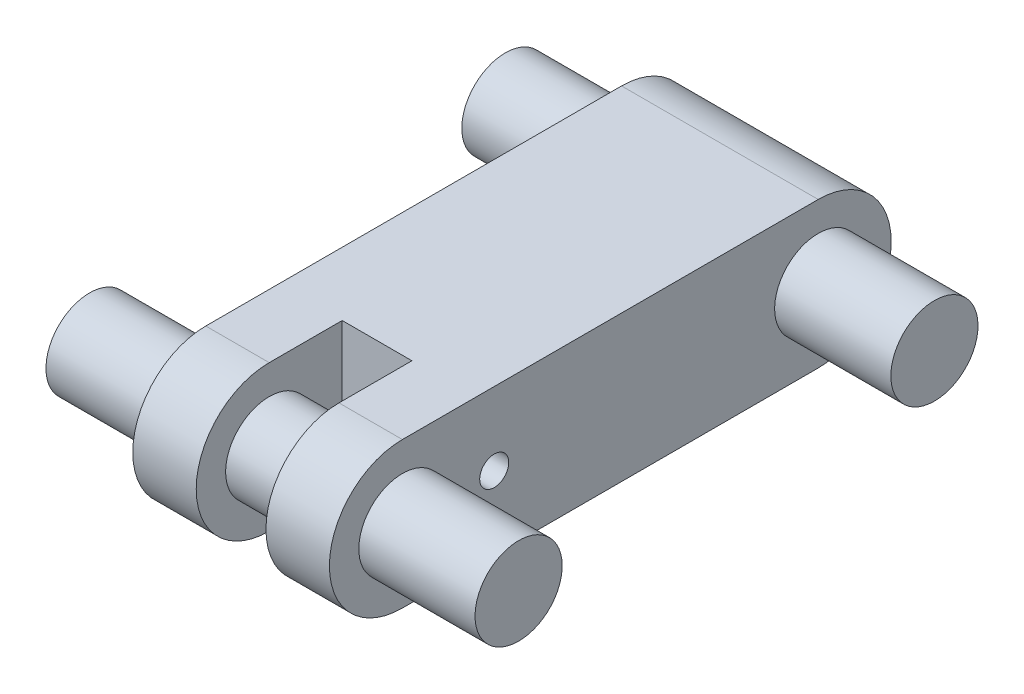
from build123d import *

# Parameters (mm, degrees)
BOSS_EXTRUDE1_DEPTH     = 338.4
CUT_EXTRUDE1_DEPTH      = 4078.516360054
BODY_MOVE_COPY1_ANGLE   = 6.4948363
CUT_EXTRUDE2_DEPTH      = 1007.656101098
CUT_EXTRUDE2_DEPTH_BACK = 1007.656101098
SKETCH8_R               = 25


with BuildPart() as part:
    # Sketch1 → Boss-Extrude1 (new body)
    with BuildSketch(Plane(origin=(-169.199995481, 0.039105561, 0), x_dir=(-0.00023112033831648726, -0.9999999732916943, 0), z_dir=(-0.9999999732916943, 0.00023112033831648726, -9.983680815562587e-14))):
        with BuildLine():
            Line((-8457.49603755, 2990.648405965), (-8376.54968012, 2279.62014296))
            ThreePointArc((-8376.54968012, 2279.62014296), (-8237.524375906, 2169.013910965), (-8126.918143911, 2308.039215179))
            Line((-8126.918143911, 2308.039215179), (-8207.864501341, 3019.067478184))
            ThreePointArc((-8207.864501341, 3019.067478184), (-8346.889805555, 3129.673710179), (-8457.49603755, 2990.648405965))
        make_face()
    extrude(amount=-BOSS_EXTRUDE1_DEPTH)

    # Sketch2 → Cut-Extrude1 (cut, through all)
    with BuildSketch(Plane(origin=(1.794312536, 7763.54214826, -883.833325812), x_dir=(0.9999999736334177, -0.00022816323452923984, 2.597503388930373e-05), z_dir=(-0.0002296370265797643, -0.9935820538684025, 0.11311343641443838))):
        Polygon((60.107789667, 4123.109536872), (-59.892210195, 4123.11267401), (-59.900592157, 3802.490672498), (60.099407705, 3802.48753536), align=None)
    extrude(amount=-CUT_EXTRUDE1_DEPTH, mode=Mode.SUBTRACT)

    # Sketch3 → Revolve1 (revolve)
    with BuildSketch(Plane(origin=(2e-09, 0, 3004.857942074), x_dir=(-1, 0, 0), z_dir=(0, 0, -1)), mode=Mode.PRIVATE) as revolve1_sk:
        Polygon((-61.943184257, 8407.666177671), (-61.925850231, 8332.666179674), (58.07414647, 8332.693914114), (58.056812444, 8407.693912112), align=None)
    revolve(revolve1_sk.sketch.rotate(Axis((61.925850233, 8332.666179674, 3004.857942074), (-0.9999999732916957, 0.0002311203324015103, 5.403085390737201e-13)), 180), axis=Axis((61.925850233, 8332.666179674, 3004.857942074), (-0.9999999732916957, 0.0002311203324015103, 5.403085390737201e-13)))

    # Sketch4 → Revolve2 (revolve)
    with BuildSketch(Plane(origin=(1e-09, 0, 2293.82967907), x_dir=(-1, 0, 0), z_dir=(0, 0, -1)), mode=Mode.PRIVATE) as revolve2_sk:
        Polygon((-371.124467697, 8326.648359994), (-371.107133671, 8251.648361997), (-171.107139013, 8251.694586065), (-171.124473038, 8326.694584062), align=None)
    revolve(revolve2_sk.sketch.rotate(Axis((371.107122989, 8251.648361999, 2293.829679069), (-0.9999999732916943, 0.0002311203383076049, 5.395684476116649e-13)), 180), axis=Axis((371.107122989, 8251.648361999, 2293.829679069), (-0.9999999732916943, 0.0002311203383076049, 5.395684476116649e-13)))

    # Sketch5 → Revolve3 (revolve)
    with BuildSketch(Plane(origin=(2e-09, 0, 3004.857942074), x_dir=(-1, 0, 0), z_dir=(0, 0, -1)), mode=Mode.PRIVATE) as revolve3_sk:
        Polygon((-371.143176046, 8407.594715262), (-371.12584202, 8332.594717265), (-171.125847362, 8332.640941332), (-171.143181387, 8407.640939329), align=None)
    revolve(revolve3_sk.sketch.rotate(Axis((371.125831339, 8332.594717267, 3004.857942074), (-0.9999999732916943, 0.00023112033830760464, 5.395684476116643e-13)), 180), axis=Axis((371.125831339, 8332.594717267, 3004.857942074), (-0.9999999732916943, 0.00023112033830760464, 5.395684476116643e-13)))

    # Sketch6 → Revolve4 (revolve)
    with BuildSketch(Plane(origin=(1e-09, 0, 2293.82967907), x_dir=(-1, 0, 0), z_dir=(0, 0, -1)), mode=Mode.PRIVATE) as revolve4_sk:
        Polygon((167.275517924, 8326.772795184), (167.292851949, 8251.772797187), (367.292846607, 8251.819021255), (367.275512582, 8326.819019252), align=None)
    revolve(revolve4_sk.sketch.rotate(Axis((-167.292862631, 8251.77279719, 2293.82967907), (-0.9999999732916943, 0.00023112033831648596, 5.41788893898131e-13)), 180), axis=Axis((-167.292862631, 8251.77279719, 2293.82967907), (-0.9999999732916943, 0.00023112033831648596, 5.41788893898131e-13)))

    # Sketch7 → Revolve5 (revolve)
    with BuildSketch(Plane(origin=(2e-09, 0, 3004.857942074), x_dir=(-1, 0, 0), z_dir=(0, 0, -1)), mode=Mode.PRIVATE) as revolve5_sk:
        Polygon((167.256809575, 8407.719150452), (167.2741436, 8332.719152455), (367.274138258, 8332.765376523), (367.256804233, 8407.765374519), align=None)
    revolve(revolve5_sk.sketch.rotate(Axis((-167.274154282, 8332.719152457, 3004.857942075), (-0.9999999732916943, 0.00023112033831648528, 5.417888938981294e-13)), 180), axis=Axis((-167.274154282, 8332.719152457, 3004.857942075), (-0.9999999732916943, 0.00023112033831648528, 5.417888938981294e-13)))


with BuildPart() as part_1:
    # Body-Move/Copy1: read off the stored shape, not the designer's step
    # Body-Move/Copy1: moved
    add(part.part.moved(Location((1.8963, 208.8730906, -934.0697721))).rotate(Axis((0, 0, 0), (0.9999979393, 0, 0.0020301439)), BODY_MOVE_COPY1_ANGLE))


with BuildPart() as part_2:
    # Body-Move/Copy2: read off the stored shape, not the designer's step
    # Body-Move/Copy2: moved
    add(part_1.part.moved(Location((-0.0396508, -8252.5008213, -3023.6625196))))

    # Sketch8 → Cut-Extrude2 (cut, two sides: drawn at the far end of the back side and taken through both)
    with BuildSketch(Plane(origin=(171.048025075, 0, -0.002243036), x_dir=(-1.311348857824843e-05, 0, -0.9999999999140183), z_dir=(0.9999999999140183, 0, -1.311348857824843e-05)).offset(-CUT_EXTRUDE2_DEPTH_BACK)):
        with Locations(Location((158.041542403, 0, 0), (0, 0, 180))):
            Circle(SKETCH8_R)
    extrude(amount=CUT_EXTRUDE2_DEPTH + CUT_EXTRUDE2_DEPTH_BACK, mode=Mode.SUBTRACT)


solid = part_2.part
